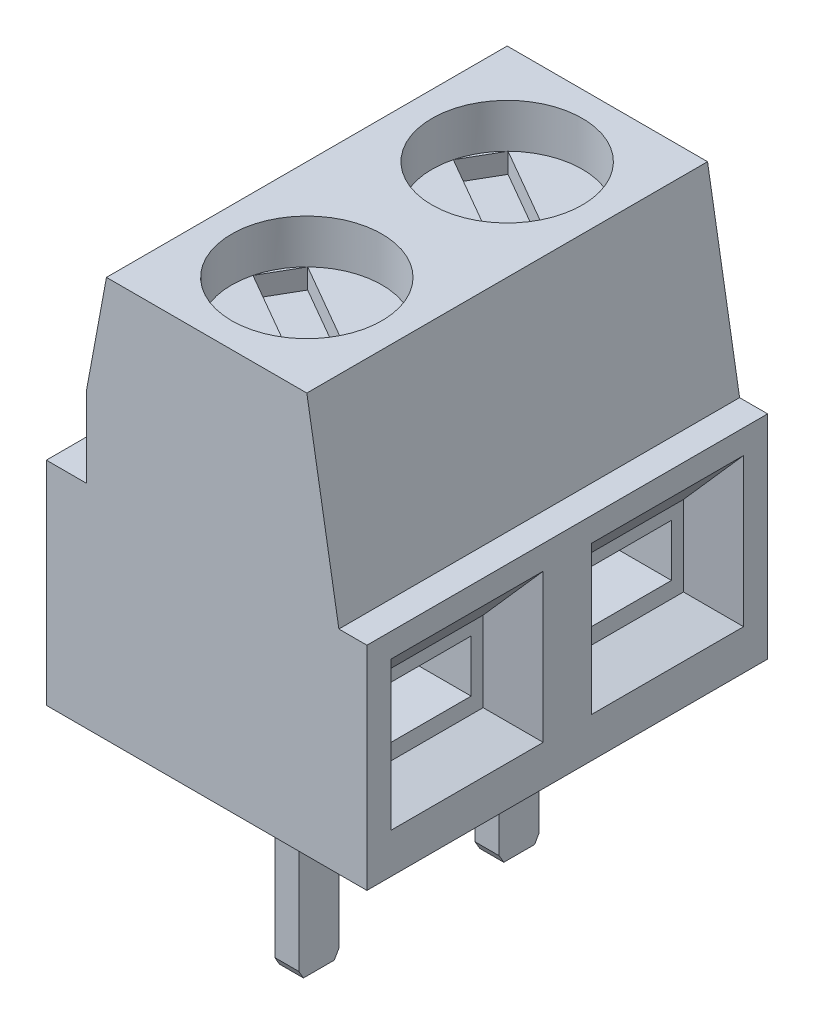
from build123d import *
from OCP.BRepFilletAPI import BRepFilletAPI_MakeChamfer

# Parameters (mm, degrees)
Z_KLAD_PROTA_EN_DEPTH    = 10
SKICA2_R                 = 1.875
ODEBR_N_PROTA_EN_1_DEPTH = 1.1
ODEBR_N_PROTA_EN_2_DEPTH = 0.5
SKICA4_W                 = 2.1
SKICA4_H                 = 3
SKICA4_W_2               = 1.2
SKICA4_H_2               = 1
ODEBR_N_PROTA_EN_3_DEPTH = 0.5
SKICA5_W                 = 2.8
SKICA5_H                 = 2
ODEBR_N_PROTA_EN_4_DEPTH = 1
LINE_RN_POLE1_COUNT      = 3
LINE_RN_POLE1_PITCH      = 5
ZKOSEN_1_SIZE            = 1.2
ZKOSEN_1_SIZE_2          = 1
ZKOSEN_2_SIZE            = 0.5
ZKOSEN_2_SIZE_2          = 1
SKICA6_W                 = 2.1
SKICA6_H                 = 1.3
ODEBR_N_PROTA_EN_5_DEPTH = 2
LINE_RN_POLE2_COUNT      = 3
LINE_RN_POLE2_PITCH      = 5
SKICA7_W                 = 0.6
SKICA7_H                 = 1
P_ID_N_PROTA_EN_1_DEPTH  = 4.8
LINE_RN_POLE3_COUNT      = 2
LINE_RN_POLE3_PITCH      = 5
ZKOSEN_3_SIZE            = 0.2
ZKOSEN_3_SIZE2           = 0.115470054


# Some blends are built 0.0001 mm under size
with BuildPart() as part:
    # Skica1 → Základ-Protažení (new body)
    with BuildSketch(Plane.XY):
        Polygon((-2.5, 10), (2.5, 10), (3.3, 5.3), (4, 5.3), (4, 0), (-4, 0), (-4, 5.3), (-3, 5.3), (-3, 7.3), align=None)
    extrude(amount=Z_KLAD_PROTA_EN_DEPTH)

    # Skica2 → Odebrání-Protažení1 (cut)
    with BuildSketch(Plane(origin=(0, 10, 0), x_dir=(-1, 0, 0), z_dir=(0, 1, 0))):
        with Locations(Location((0, 2.5, 0), (0, 0, 90))):
            Circle(SKICA2_R)
        with Locations(Location((0, 7.5, 0), (0, 0, 90))):
            Circle(SKICA2_R)
    extrude(amount=-ODEBR_N_PROTA_EN_1_DEPTH, mode=Mode.SUBTRACT)

    # Skica3 → Odebrání-Protažení2 (cut)
    with BuildSketch(Plane(origin=(0, 8.9, 0), x_dir=(-1, 0, 0), z_dir=(0, 1, 0))):
        Polygon((1.814998003, 2.029460683), (-1.314998003, 3.83656472), (-1.814998003, 2.970539317), (1.314998003, 1.16343528), align=None)
        Polygon((-1.314998003, 8.83656472), (1.814998003, 7.029460683), (1.314998003, 6.16343528), (-1.814998003, 7.970539317), align=None)
    extrude(amount=-ODEBR_N_PROTA_EN_2_DEPTH, mode=Mode.SUBTRACT)

    # Skica4 → Odebrání-Protažení3 (cut)
    with BuildSketch(Plane.ZY.offset(4)):
        with Locations((7.5, 3.8)):
            Rectangle(SKICA4_W, SKICA4_H)
        with Locations((7.5, 0.5)):
            Rectangle(SKICA4_W_2, SKICA4_H_2)
        with Locations((2.5, 3.8)):
            Rectangle(SKICA4_W, SKICA4_H)
        with Locations((2.5, 0.5)):
            Rectangle(SKICA4_W_2, SKICA4_H_2)
        with Locations((-2.5, 3.8)):
            Rectangle(SKICA4_W, SKICA4_H)
        with Locations((-2.5, 0.5)):
            Rectangle(SKICA4_W_2, SKICA4_H_2)
    extrude(amount=-ODEBR_N_PROTA_EN_3_DEPTH, mode=Mode.SUBTRACT)

    # Skica5 → Odebrání-Protažení4 (cut)
    with BuildSketch(Plane(origin=(4, 0, 0), x_dir=(0, 0, -1), z_dir=(1, 0, 0))):
        with Locations((-7.5, 2.5)):
            Rectangle(SKICA5_W, SKICA5_H)
    odebr_n_prota_en_4 = extrude(amount=-ODEBR_N_PROTA_EN_4_DEPTH, mode=Mode.SUBTRACT)

    # Lineární Pole1: Odebrání-Protažení4 ×3
    with Locations(*[(0, 0, -i * LINE_RN_POLE1_PITCH) for i in range(1, LINE_RN_POLE1_COUNT)]):
        add(odebr_n_prota_en_4, mode=Mode.SUBTRACT)

    # Zkosení1
    # the kernel refuses this chamfer: 1.2, 1 mm, written as the material it adds along each edge
    # the kernel refuses this chamfer: 1.2, 1 mm, written as the material it takes off along each edge
    with BuildSketch(Plane(origin=(4, 3.5, 8.9), x_dir=(0.024836286378920516, 0.9996915318631564, 0), z_dir=(0, 0, -1)), Plane(origin=(4, 3.5, 3.9), x_dir=(0.024836286378920516, 0.9996915318631564, 0), z_dir=(0, 0, -1))) as zkosen_1_2_piece_1:
        Polygon((ZKOSEN_1_SIZE * 0.999691531863, -ZKOSEN_1_SIZE * 0.0248362863789), (-ZKOSEN_1_SIZE_2 * 0.0248362863789, -ZKOSEN_1_SIZE_2 * 0.999691531863), (0, 0), align=None)
    extrude(amount=2.8, mode=Mode.SUBTRACT)
    with BuildSketch(Plane(origin=(4, 3.5, 11.993140689), x_dir=(0.024836286378920505, 0.9996915318631564, 0), z_dir=(0, 0, -1))) as zkosen_1_2_piece_2_section:
        Polygon((ZKOSEN_1_SIZE * 0.999691531863, -ZKOSEN_1_SIZE * 0.0248362863789), (-ZKOSEN_1_SIZE_2 * 0.0248362863789, -ZKOSEN_1_SIZE_2 * 0.999691531863), (0, 0), align=None)
    zkosen_1_2_piece_2 = extrude(amount=8.986281378, mode=Mode.PRIVATE)
    zkosen_1_2_piece_2 = split(zkosen_1_2_piece_2, bisect_by=Plane(origin=(3.666666667, 3.9, 3.9), z_dir=(0, 0, -1)), keep=Keep.TOP, mode=Mode.PRIVATE)
    add(zkosen_1_2_piece_2, mode=Mode.SUBTRACT)
    with BuildSketch(Plane(origin=(4, 3.5, 6.993140689), x_dir=(0.024836286378920505, 0.9996915318631564, 0), z_dir=(0, 0, -1))) as zkosen_1_2_piece_3_section:
        Polygon((ZKOSEN_1_SIZE * 0.999691531863, -ZKOSEN_1_SIZE * 0.0248362863789), (-ZKOSEN_1_SIZE_2 * 0.0248362863789, -ZKOSEN_1_SIZE_2 * 0.999691531863), (0, 0), align=None)
    zkosen_1_2_piece_3 = extrude(amount=8.986281378, mode=Mode.PRIVATE)
    zkosen_1_2_piece_3 = split(zkosen_1_2_piece_3, bisect_by=Plane(origin=(3.666666667, 3.9, 6.1), z_dir=(0, 0, 1)), keep=Keep.TOP, mode=Mode.PRIVATE)
    add(zkosen_1_2_piece_3, mode=Mode.SUBTRACT)

    # Zkosení2
    zkosen_2_edges_1 = [part.edges().sort_by_distance(p)[0] for p in [
        (4, 3.1, 8.9),
    ]]
    zkosen_2_side_1 = [part.faces().sort_by_distance(p)[0] for p in [
        (4, 3.1, 8.91),
    ]]
    zkosen_2_edges_2 = [part.edges().sort_by_distance(p)[0] for p in [
        (4, 1.5, 7.5),
    ]]
    zkosen_2_side_2 = [part.faces().sort_by_distance(p)[0] for p in [
        (4, 1.49, 7.5),
    ]]
    zkosen_2_edges_3 = [part.edges().sort_by_distance(p)[0] for p in [
        (4, 3.1, 6.1),
    ]]
    zkosen_2_side_3 = [part.faces().sort_by_distance(p)[0] for p in [
        (4, 3.1, 6.09),
    ]]
    zkosen_2_edges_4 = [part.edges().sort_by_distance(p)[0] for p in [
        (4, 3.1, 3.9),
    ]]
    zkosen_2_side_4 = [part.faces().sort_by_distance(p)[0] for p in [
        (4, 3.1, 3.91),
    ]]
    zkosen_2_edges_5 = [part.edges().sort_by_distance(p)[0] for p in [
        (4, 1.5, 2.5),
    ]]
    zkosen_2_side_5 = [part.faces().sort_by_distance(p)[0] for p in [
        (4, 1.49, 2.5),
    ]]
    zkosen_2_edges_6 = [part.edges().sort_by_distance(p)[0] for p in [
        (4, 3.1, 1.1),
    ]]
    zkosen_2_side_6 = [part.faces().sort_by_distance(p)[0] for p in [
        (4, 3.1, 1.09),
    ]]
    zkosen_2 = BRepFilletAPI_MakeChamfer(part.part.solid().wrapped)
    for e in zkosen_2_edges_1:
        zkosen_2.Add(ZKOSEN_2_SIZE - 0.0001, ZKOSEN_2_SIZE_2 - 0.0001, e.wrapped, zkosen_2_side_1[0].wrapped)
    for e in zkosen_2_edges_2:
        zkosen_2.Add(ZKOSEN_2_SIZE - 0.0001, ZKOSEN_2_SIZE_2 - 0.0001, e.wrapped, zkosen_2_side_2[0].wrapped)
    for e in zkosen_2_edges_3:
        zkosen_2.Add(ZKOSEN_2_SIZE - 0.0001, ZKOSEN_2_SIZE_2 - 0.0001, e.wrapped, zkosen_2_side_3[0].wrapped)
    for e in zkosen_2_edges_4:
        zkosen_2.Add(ZKOSEN_2_SIZE - 0.0001, ZKOSEN_2_SIZE_2 - 0.0001, e.wrapped, zkosen_2_side_4[0].wrapped)
    for e in zkosen_2_edges_5:
        zkosen_2.Add(ZKOSEN_2_SIZE - 0.0001, ZKOSEN_2_SIZE_2 - 0.0001, e.wrapped, zkosen_2_side_5[0].wrapped)
    for e in zkosen_2_edges_6:
        zkosen_2.Add(ZKOSEN_2_SIZE - 0.0001, ZKOSEN_2_SIZE_2 - 0.0001, e.wrapped, zkosen_2_side_6[0].wrapped)
    add(Compound.cast(zkosen_2.Shape()), mode=Mode.REPLACE)  # a hair under: the kernel refuses the full size

    # Skica6 → Odebrání-Protažení5 (cut)
    with BuildSketch(Plane(origin=(3, 0, 0), x_dir=(0, 0, -1), z_dir=(1, 0, 0))):
        with Locations((-7.45, 2.55)):
            Rectangle(SKICA6_W, SKICA6_H)
    odebr_n_prota_en_5 = extrude(amount=-ODEBR_N_PROTA_EN_5_DEPTH, mode=Mode.SUBTRACT)

    # Lineární Pole2: Odebrání-Protažení5 ×3
    with Locations(*[(0, 0, -i * LINE_RN_POLE2_PITCH) for i in range(1, LINE_RN_POLE2_COUNT)]):
        add(odebr_n_prota_en_5, mode=Mode.SUBTRACT)

    # Skica7 → Přidání-Protažení1 (add)
    with BuildSketch(Plane.XZ):
        with Locations((0, 2.5)):
            Rectangle(SKICA7_W, SKICA7_H)
    p_id_n_prota_en_1 = extrude(amount=P_ID_N_PROTA_EN_1_DEPTH)

    # Lineární Pole3: Přidání-Protažení1 ×2
    with Locations(*[(0, 0, i * LINE_RN_POLE3_PITCH) for i in range(1, LINE_RN_POLE3_COUNT)]):
        add(p_id_n_prota_en_1)

    # Zkosení3: one chamfer whose edges measure the first distance from different faces: ONE call of the kernel's chamfer builder (chamfer() names one face for all edges)
    zkosen_3_edges_1 = [part.edges().sort_by_distance(p)[0] for p in [
        (0, -4.8, 2),
    ]]
    zkosen_3_side_1 = [part.faces().sort_by_distance(p)[0] for p in [
        (0, -2.4, 2),
    ]]
    zkosen_3_edges_2 = [part.edges().sort_by_distance(p)[0] for p in [
        (0, -4.8, 3),
    ]]
    zkosen_3_side_2 = [part.faces().sort_by_distance(p)[0] for p in [
        (0, -2.4, 3),
    ]]
    zkosen_3_edges_3 = [part.edges().sort_by_distance(p)[0] for p in [
        (0, -4.8, 7),
    ]]
    zkosen_3_side_3 = [part.faces().sort_by_distance(p)[0] for p in [
        (0, -2.4, 7),
    ]]
    zkosen_3_edges_4 = [part.edges().sort_by_distance(p)[0] for p in [
        (0, -4.8, 8),
    ]]
    zkosen_3_side_4 = [part.faces().sort_by_distance(p)[0] for p in [
        (0, -2.4, 8),
    ]]
    zkosen_3 = BRepFilletAPI_MakeChamfer(part.part.solid().wrapped)
    for e in zkosen_3_edges_1:
        zkosen_3.Add(ZKOSEN_3_SIZE, ZKOSEN_3_SIZE2, e.wrapped, zkosen_3_side_1[0].wrapped)  # the first distance lies on this face
    for e in zkosen_3_edges_2:
        zkosen_3.Add(ZKOSEN_3_SIZE, ZKOSEN_3_SIZE2, e.wrapped, zkosen_3_side_2[0].wrapped)  # the first distance lies on this face
    for e in zkosen_3_edges_3:
        zkosen_3.Add(ZKOSEN_3_SIZE, ZKOSEN_3_SIZE2, e.wrapped, zkosen_3_side_3[0].wrapped)  # the first distance lies on this face
    for e in zkosen_3_edges_4:
        zkosen_3.Add(ZKOSEN_3_SIZE, ZKOSEN_3_SIZE2, e.wrapped, zkosen_3_side_4[0].wrapped)  # the first distance lies on this face
    add(Compound.cast(zkosen_3.Shape()), mode=Mode.REPLACE)


solid = part.part
